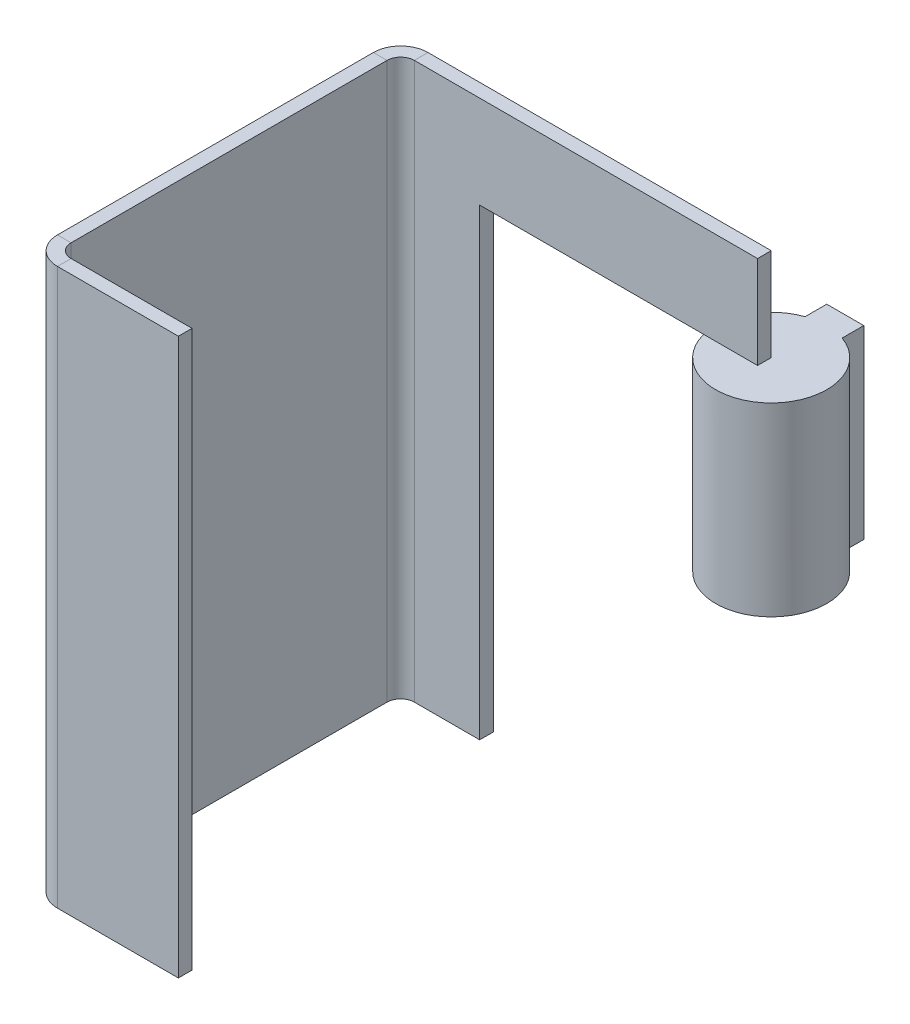
from build123d import *

# Parameters (mm, degrees)
BASE_FLANGE1_DEPTH  = 30
SKETCH6_W           = 15
SKETCH6_H           = 5
TAB1_DEPTH          = 0.7366
SKETCH9_R           = 3
SKETCH9_W           = 2
SKETCH9_H           = 1.993597438
BOSS_EXTRUDE1_DEPTH = 10


# Sheet-metal steps are written as plain solids
with BuildPart() as part:
    # Sketch1 → Base-Flange1 (new body)
    with BuildSketch(Plane(origin=(0, 0, 0), x_dir=(1, 0, 0), z_dir=(0, 1, 0))):
        with BuildLine():
            Line((8, 0), (1.4732, 0))
            ThreePointArc((1.4732, 0), (0.43149029, 0.43149029), (0, 1.4732))
            Line((0, 1.4732), (0, 18.5268))
            ThreePointArc((0, 18.5268), (0.43149029, 19.56850971), (1.4732, 20))
            Line((1.4732, 20), (5, 20))
            Line((5, 20), (5, 19.2634))
            Line((5, 19.2634), (1.4732, 19.2634))
            ThreePointArc((1.4732, 19.2634), (0.952345145, 19.047654855), (0.7366, 18.5268))
            Line((0.7366, 18.5268), (0.7366, 1.4732))
            ThreePointArc((0.7366, 1.4732), (0.952345145, 0.952345145), (1.4732, 0.7366))
            Line((1.4732, 0.7366), (8, 0.7366))
            Line((8, 0.7366), (8, 0))
        make_face()
    extrude(amount=BASE_FLANGE1_DEPTH)

    # Sketch6 → Tab1 (add)
    with BuildSketch(Plane(origin=(0, 0, -20), x_dir=(-1, 0, 0), z_dir=(0, 0, -1))):
        with Locations((-12.5, 27.5)):
            Rectangle(SKETCH6_W, SKETCH6_H)
    extrude(amount=-TAB1_DEPTH)

    # Sketch9 → Boss-Extrude1 (add)
    with BuildSketch(Plane.XZ.offset(-25)):
        with Locations((20, -20)):
            Circle(SKETCH9_R)
        with Locations((20, -23)):
            Rectangle(SKETCH9_W, SKETCH9_H)
    extrude(amount=BOSS_EXTRUDE1_DEPTH)


solid = part.part
